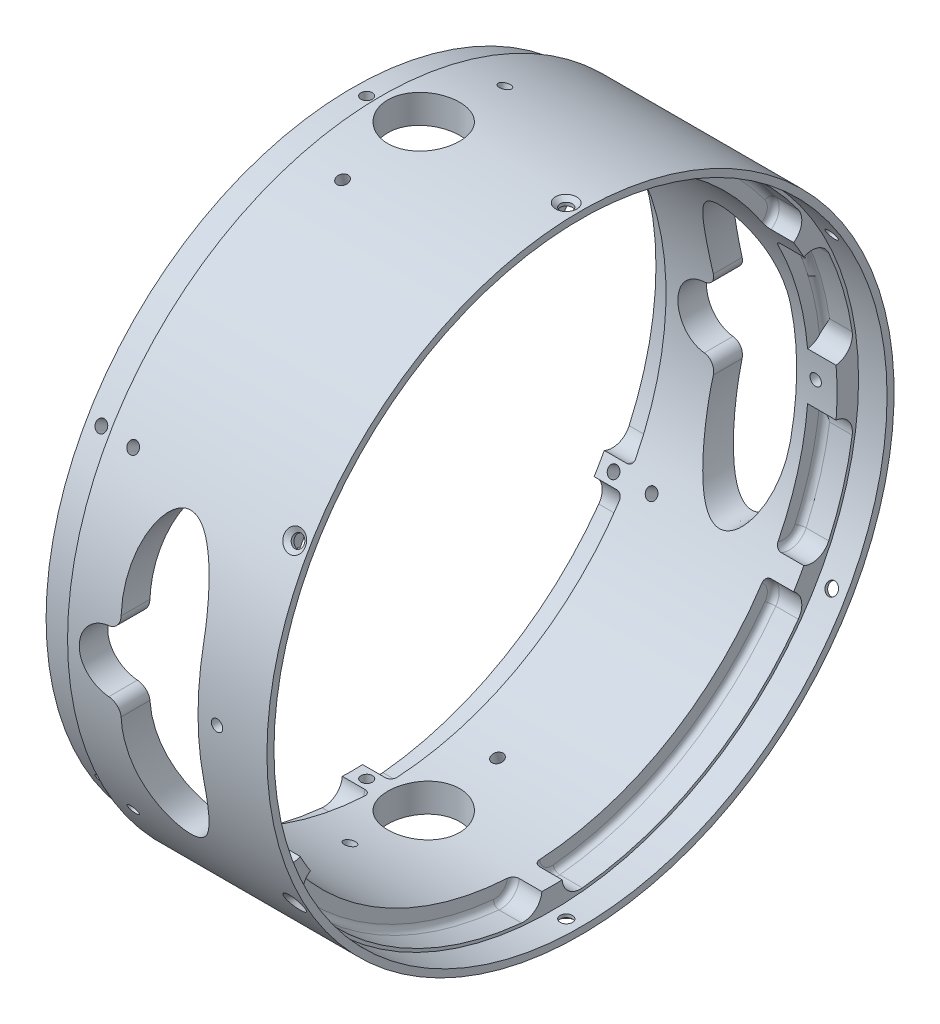
from build123d import *
from build123d.topology import SkipClean

# Parameters (mm, degrees)
F_31_0_12_DIAMETER_HOLE1_REACH                    = 196.298
F_31_0_12_DIAMETER_HOLE1_BORE_R                   = 1.524
CIRPATTERN4_COUNT                                 = 6
CUT_EXTRUDE1_DEPTH                                = 7.62
CUT_EXTRUDE2_START                                = -7.62
CUT_EXTRUDE2_DEPTH                                = 7.62
FILLET1_R                                         = 1.5875
CIRPATTERN6_COUNT                                 = 6
FILLET1_OF_CIRPATTERN6_R                          = 1.5875
CSK_FOR_4_FLAT_HEAD_MACHINE_SCREW_100_D           = 3.2639
CSK_FOR_4_FLAT_HEAD_MACHINE_SCREW_100_CSINK_D     = 5.715
CSK_FOR_4_FLAT_HEAD_MACHINE_SCREW_100_CSINK_ANGLE = 100
CIRPATTERN5_COUNT                                 = 6
CUT_EXTRUDE5_DEPTH                                = 148.905795136
CUT_EXTRUDE5_DEPTH_BACK                           = 148.905795136
CUT_EXTRUDE13_DEPTH                               = 130.987462642
CUT_EXTRUDE13_DEPTH_BACK                          = 130.987462642
SKETCH23_R                                        = 9.5885
BOSS_EXTRUDE1_REACH                               = 190.354
F_31_START                                        = -158
F_31_0_12_DIAMETER_HOLE2_OUTLINE_R                = 1.524
F_31_0_12_DIAMETER_HOLE2_DEPTH                    = 9
F_31_0_12_DIAMETER_HOLE2_2_OUTLINE_R              = 1.524
F_31_0_12_DIAMETER_HOLE2_2_DEPTH                  = 9
F_31_START_2                                      = -123
F_31_0_12_DIAMETER_HOLE2_3_OUTLINE_R              = 1.524
F_31_0_12_DIAMETER_HOLE2_3_DEPTH                  = 10
F_31_START_3                                      = 37
F_31_0_12_DIAMETER_HOLE2_4_OUTLINE_R              = 1.524
F_31_0_12_DIAMETER_HOLE2_4_DEPTH                  = 10
F_31_START_4                                      = 75
F_31_0_12_DIAMETER_HOLE2_5_OUTLINE_R              = 1.524
F_31_0_12_DIAMETER_HOLE2_5_DEPTH                  = 10
CIRPATTERN7_COUNT                                 = 2


with BuildPart() as part:
    # Sketch1 → Revolve2 (revolve)
    with BuildSketch(Plane.XY, mode=Mode.PRIVATE) as revolve2_sk:
        Polygon((-0.762, 7.62), (7.62, 7.62), (7.62, 5.7404), (0, 5.7404), (0, 0), (-53.34, 0), (-53.34, 5.6896), (-45.6692, 5.6896), (-45.6692, 7.62), align=None)
    revolve(revolve2_sk.sketch.rotate(Axis((-51.956158524, -76.2, 0), (1, 0, 0)), 90), axis=Axis((-51.956158524, -76.2, 0), (1, 0, 0)))

    # #31 (0.12) Diameter Hole1 bore (on position points) → #31 (0.12) Diameter Hole1 (cut, up to next)
    with BuildSketch(Plane(origin=(-49.53, -158.0896, 0), x_dir=(0, 0, -1), z_dir=(0, -1, 0)), mode=Mode.PRIVATE) as f_31_0_12_diameter_hole1_sk1:
        Circle(F_31_0_12_DIAMETER_HOLE1_BORE_R)
    f_31_0_12_diameter_hole1_tool1 = extrude(f_31_0_12_diameter_hole1_sk1.sketch, amount=-F_31_0_12_DIAMETER_HOLE1_REACH, mode=Mode.PRIVATE) & part.part
    f_31_0_12_diameter_hole1 = f_31_0_12_diameter_hole1_tool1.solids().sort_by_distance((-49.53, -158.0896, 0))[0]
    add(f_31_0_12_diameter_hole1, mode=Mode.SUBTRACT)

    # CirPattern4: #31 (0.12) Diameter Hole1 ×6 about axis
    cirpattern4_axis = Axis((0, -76.2, 0), (1, 0, 0))
    for i in range(1, CIRPATTERN4_COUNT):
        add(f_31_0_12_diameter_hole1.rotate(cirpattern4_axis, i * 360 / CIRPATTERN4_COUNT), mode=Mode.SUBTRACT)

    # Sketch8 → Cut-Extrude1 (cut)
    with BuildSketch(Plane.ZY.offset(53.34)):
        with BuildLine():
            ThreePointArc((-64.590076174, -116.629717533), (-66.692018058, -119.849215758), (-65.841049379, -123.598773174))
            ThreePointArc((-65.841049379, -123.598773174), (-40.5638, -146.458562548), (-8.128016987, -156.919407961))
            ThreePointArc((-8.128016987, -156.919407961), (-4.455320673, -155.781589747), (-2.718124364, -152.351505566))
            ThreePointArc((-2.718124364, -152.351505566), (-38.1, -142.191135768), (-64.590076174, -116.629717533))
        make_face()
    cut_extrude1 = extrude(amount=-CUT_EXTRUDE1_DEPTH, mode=Mode.SUBTRACT)

    # Sketch13 → Cut-Extrude2 (cut)
    with BuildSketch(Plane(origin=(0, 0, 0), x_dir=(0, 0, -1), z_dir=(1, 0, 0)).offset(CUT_EXTRUDE2_START)):
        with BuildLine():
            ThreePointArc((64.590076174, -116.629717533), (38.1, -142.191135768), (2.718124364, -152.351505566))
            ThreePointArc((2.718124364, -152.351505566), (4.455320673, -155.781589747), (8.128016987, -156.919407961))
            ThreePointArc((8.128016987, -156.919407961), (40.5638, -146.458562548), (65.841049379, -123.598773174))
            ThreePointArc((65.841049379, -123.598773174), (66.692018058, -119.849215758), (64.590076174, -116.629717533))
        make_face()
    cut_extrude2 = extrude(amount=CUT_EXTRUDE2_DEPTH, mode=Mode.SUBTRACT)

    # Fillet1
    fillet1_edges = [part.edges().sort_by_distance(p)[0] for p in [
        (-45.72, -146.458562548, -40.5638),
        (-45.72, -119.849215758, -66.692018058),
        (-45.72, -155.781589747, -4.455320673),
        (-7.62, -155.781589747, -4.455320673),
        (-7.62, -119.849215758, -66.692018058),
        (-7.62, -146.458562548, -40.5638),
    ]]
    fillet(fillet1_edges, radius=FILLET1_R)

    # CirPattern6: Cut-Extrude1, Cut-Extrude2 ×6 about axis
    cirpattern6_axis = Axis((0, -76.2, 0), (1, 0, 0))
    add([cut_extrude1.rotate(cirpattern6_axis, i * 360 / CIRPATTERN6_COUNT) for i in range(1, CIRPATTERN6_COUNT)], mode=Mode.SUBTRACT)
    add([cut_extrude2.rotate(cirpattern6_axis, i * 360 / CIRPATTERN6_COUNT) for i in range(1, CIRPATTERN6_COUNT)], mode=Mode.SUBTRACT)

    # Fillet1 of CirPattern6
    fillet1_of_cirpattern6_edges = [part.edges().sort_by_distance(p)[0] for p in [
        (-45.72, -76.2, -81.1276),
        (-45.72, -40.267626011, -71.147338731),
        (-45.72, -112.132373989, -71.147338731),
        (-7.62, -112.132373989, -71.147338731),
        (-7.62, -40.267626011, -71.147338731),
        (-7.62, -76.2, -81.1276),
        (-45.72, -5.941437452, -40.5638),
        (-45.72, 3.381589747, -4.455320673),
        (-45.72, -32.550784242, -66.692018058),
        (-7.62, -32.550784242, -66.692018058),
        (-7.62, 3.381589747, -4.455320673),
        (-7.62, -5.941437452, -40.5638),
        (-45.72, -5.941437452, 40.5638),
        (-45.72, -32.550784242, 66.692018058),
        (-45.72, 3.381589747, 4.455320673),
        (-7.62, 3.381589747, 4.455320673),
        (-7.62, -32.550784242, 66.692018058),
        (-7.62, -5.941437452, 40.5638),
        (-45.72, -76.2, 81.1276),
        (-45.72, -112.132373989, 71.147338731),
        (-45.72, -40.267626011, 71.147338731),
        (-7.62, -40.267626011, 71.147338731),
        (-7.62, -112.132373989, 71.147338731),
        (-7.62, -76.2, 81.1276),
        (-45.72, -146.458562548, 40.5638),
        (-45.72, -155.781589747, 4.455320673),
        (-45.72, -119.849215758, 66.692018058),
        (-7.62, -119.849215758, 66.692018058),
        (-7.62, -155.781589747, 4.455320673),
        (-7.62, -146.458562548, 40.5638),
    ]]
    fillet(fillet1_of_cirpattern6_edges, radius=FILLET1_OF_CIRPATTERN6_R)

    # CSK for #4 Flat Head Machine Screw (100)1 (through all)
    with Locations(Plane(origin=(3.81, -160.02, 0), x_dir=(0, 0, -1), z_dir=(0, -1, 0))):
        with Locations((0, 0)):
            csk_for_4_flat_head_machine_screw_100 = CounterSinkHole(CSK_FOR_4_FLAT_HEAD_MACHINE_SCREW_100_D / 2, CSK_FOR_4_FLAT_HEAD_MACHINE_SCREW_100_CSINK_D / 2, counter_sink_angle=CSK_FOR_4_FLAT_HEAD_MACHINE_SCREW_100_CSINK_ANGLE)

    # CirPattern5: CSK for #4 Flat Head Machine Screw (100)1 ×6 about axis
    cirpattern5_axis = Axis((7.62, -76.2, 0), (-1, 0, 0))
    for i in range(1, CIRPATTERN5_COUNT):
        add(csk_for_4_flat_head_machine_screw_100.rotate(cirpattern5_axis, i * 360 / CIRPATTERN5_COUNT), mode=Mode.SUBTRACT)

    # Sketch22 → Cut-Extrude5 (cut, two sides: drawn at the far end of the back side and taken through both)
    with BuildSketch(Plane(origin=(12.465755717, -76.935542211, -18.141203309), x_dir=(1, 0, 0), z_dir=(0, 0, 1)).offset(-CUT_EXTRUDE5_DEPTH_BACK)):
        with BuildLine():
            ThreePointArc((-44.645862848, -10.958742352), (-45.356953283, -8.624882812), (-47.513859586, -7.484573575))
            ThreePointArc((-47.513859586, -7.484573575), (-55.010755717, 0.735542211), (-47.513859586, 8.955657996))
            ThreePointArc((-47.513859586, 8.955657996), (-45.356953283, 10.095967233), (-44.645862848, 12.429826773))
            add(Edge.make_bspline(
                [(-23.260755717, 16.62042399), (-23.260755717, 40.42922599), (-35.108647383, 38.10752886), (-46.956539048, 35.785831731), (-44.645862848, 12.429826773)],
                knots=[4.71238898, 4.71238898, 4.71238898, 6.380854752, 6.380854752, 8.049320524, 8.049320524, 8.049320524], degree=2, weights=[1, 0.671746144, 1, 0.671746144, 1]))
            Line((-23.260755717, 16.62042399), (-23.260755717, -15.149339569))
            add(Edge.make_bspline(
                [(-44.645862848, -10.958742352), (-46.956539048, -34.31474731), (-35.108647383, -36.636444439), (-23.260755717, -38.958141569), (-23.260755717, -15.149339569)],
                knots=[4.51705009, 4.51705009, 4.51705009, 6.185515862, 6.185515862, 7.853981634, 7.853981634, 7.853981634], degree=2, weights=[1, 0.671746144, 1, 0.671746144, 1]))
        make_face()
    extrude(amount=CUT_EXTRUDE5_DEPTH + CUT_EXTRUDE5_DEPTH_BACK, mode=Mode.SUBTRACT)

    # Sketch23 → Cut-Extrude13 (cut, two sides: drawn at the far end of the back side and taken through both)
    with BuildSketch(Plane(origin=(0, -76.2, 0), x_dir=(1, 0, 0), z_dir=(0, 1, 0)).offset(-CUT_EXTRUDE13_DEPTH_BACK)):
        with Locations(Location((-34.29, 0, 0), (0, 0, 270))):
            Circle(SKETCH23_R)
    extrude(amount=CUT_EXTRUDE13_DEPTH + CUT_EXTRUDE13_DEPTH_BACK, mode=Mode.SUBTRACT)

    # Sketch25 → Boss-Extrude1 (add, up to next)
    with BuildSketch(Plane(origin=(0, 0, 0), x_dir=(0, 0, -1), z_dir=(1, 0, 0)), mode=Mode.PRIVATE) as boss_extrude1_sk1:
        with BuildLine():
            ThreePointArc((-75.934955719, -69.85), (-76.2, -76.2), (-75.934955719, -82.55))
            ThreePointArc((-75.934955719, -82.55), (-79.278207608, -84.448945843), (-80.239418371, -88.171767672))
            ThreePointArc((-80.239418371, -88.171767672), (-81.1276, -76.2), (-80.239418371, -64.228232328))
            ThreePointArc((-80.239418371, -64.228232328), (-79.278207608, -67.951054157), (-75.934955719, -69.85))
        make_face()
    boss_extrude1_tool1 = extrude(boss_extrude1_sk1.sketch, amount=-BOSS_EXTRUDE1_REACH, mode=Mode.PRIVATE) - part.part
    # Sketch25 → Boss-Extrude1 (add, up to next)
    with BuildSketch(Plane(origin=(0, 0, 0), x_dir=(0, 0, -1), z_dir=(1, 0, 0)), mode=Mode.PRIVATE) as boss_extrude1_sk2:
        with BuildLine():
            ThreePointArc((75.934955719, -69.85), (79.278207608, -67.951054157), (80.239418371, -64.228232328))
            ThreePointArc((80.239418371, -64.228232328), (81.1276, -76.2), (80.239418371, -88.171767672))
            ThreePointArc((80.239418371, -88.171767672), (79.278207608, -84.448945843), (75.934955719, -82.55))
            ThreePointArc((75.934955719, -82.55), (76.2, -76.2), (75.934955719, -69.85))
        make_face()
    boss_extrude1_tool2 = extrude(boss_extrude1_sk2.sketch, amount=-BOSS_EXTRUDE1_REACH, mode=Mode.PRIVATE) - part.part
    add(boss_extrude1_tool1.solids().sort_by_distance((0, -76.2, 78.749805))[0])
    add(boss_extrude1_tool2.solids().sort_by_distance((0, -76.2, -78.749805))[0])

    # #31 (0.12) Diameter Hole2: read off the stored shape, not the designer's step
    # #31 (0.12) Diameter Hole2 outline → #31 (0.12) Diameter Hole2 (cut)
    with SkipClean():  # the faces are left unmerged after this step: merging them gives an invalid solid
        with BuildSketch(Plane(origin=(0, 0, 0), x_dir=(1, 0, 0), z_dir=(0, 0.9659258262890699, -0.258819045102515)).offset(F_31_START)):
            with Locations((-34.29, 19.722011237)):
                Circle(F_31_0_12_DIAMETER_HOLE2_OUTLINE_R)
        f_31_0_12_diameter_hole2 = extrude(amount=F_31_0_12_DIAMETER_HOLE2_DEPTH, mode=Mode.SUBTRACT)

    # 31 _0.12_ Diameter Hole2 2 outline → 31 _0.12_ Diameter Hole2 2 (cut)
    with SkipClean():  # the faces are left unmerged after this step: merging them gives an invalid solid
        with BuildSketch(Plane(origin=(0, 0, 0), x_dir=(1, 0, 0), z_dir=(0, 0.9659258262890696, 0.25881904510251597)).offset(F_31_START)):
            with Locations((-34.29, -19.722011237)):
                Circle(F_31_0_12_DIAMETER_HOLE2_2_OUTLINE_R)
        f_31_0_12_diameter_hole2_2 = extrude(amount=F_31_0_12_DIAMETER_HOLE2_2_DEPTH, mode=Mode.SUBTRACT)

    # 31 _0.12_ Diameter Hole2 3 outline → 31 _0.12_ Diameter Hole2 3 (cut)
    with SkipClean():  # the faces are left unmerged after this step: merging them gives an invalid solid
        with BuildSketch(Plane(origin=(0, 0, 0), x_dir=(1, 0, 0), z_dir=(0, 0.49996809917136886, -0.8660438209530558)).offset(F_31_START_2)):
            with Locations((-39.37, 65.992539157)):
                Circle(F_31_0_12_DIAMETER_HOLE2_3_OUTLINE_R)
        f_31_0_12_diameter_hole2_3 = extrude(amount=F_31_0_12_DIAMETER_HOLE2_3_DEPTH, mode=Mode.SUBTRACT)

    # 31 _0.12_ Diameter Hole2 4 outline → 31 _0.12_ Diameter Hole2 4 (cut)
    with SkipClean():  # the faces are left unmerged after this step: merging them gives an invalid solid
        with BuildSketch(Plane(origin=(0, 0, 0), x_dir=(1, 0, 0), z_dir=(0, 0.4999680991713681, 0.8660438209530562)).offset(F_31_START_3)):
            with Locations((-39.37, -65.992539157)):
                Circle(F_31_0_12_DIAMETER_HOLE2_4_OUTLINE_R)
        f_31_0_12_diameter_hole2_4 = extrude(amount=F_31_0_12_DIAMETER_HOLE2_4_DEPTH, mode=Mode.SUBTRACT)

    # 31 _0.12_ Diameter Hole2 5 outline → 31 _0.12_ Diameter Hole2 5 (cut)
    with SkipClean():  # the faces are left unmerged after this step: merging them gives an invalid solid
        with BuildSketch(Plane.XY.offset(F_31_START_4)):
            with Locations((-5.715, -76.2)):
                Circle(F_31_0_12_DIAMETER_HOLE2_5_OUTLINE_R)
        f_31_0_12_diameter_hole2_5 = extrude(amount=F_31_0_12_DIAMETER_HOLE2_5_DEPTH, mode=Mode.SUBTRACT)

    # CirPattern7: #31 (0.12) Diameter Hole2, 31 _0.12_ Diameter Hole2 2, 31 _0.12_ Diameter Hole2 3, 31 _0.12_ Diameter Hole2 4, 31 _0.12_ Diameter Hole2 5 ×2 about axis
    with SkipClean():  # the faces are left unmerged after this step: merging them gives an invalid solid
        cirpattern7_axis = Axis((7.62, -76.2, 0), (-1, 0, 0))
        add([f_31_0_12_diameter_hole2.rotate(cirpattern7_axis, i * 360 / CIRPATTERN7_COUNT) for i in range(1, CIRPATTERN7_COUNT)], mode=Mode.SUBTRACT)
        add([f_31_0_12_diameter_hole2_2.rotate(cirpattern7_axis, i * 360 / CIRPATTERN7_COUNT) for i in range(1, CIRPATTERN7_COUNT)], mode=Mode.SUBTRACT)
        add([f_31_0_12_diameter_hole2_3.rotate(cirpattern7_axis, i * 360 / CIRPATTERN7_COUNT) for i in range(1, CIRPATTERN7_COUNT)], mode=Mode.SUBTRACT)
        add([f_31_0_12_diameter_hole2_4.rotate(cirpattern7_axis, i * 360 / CIRPATTERN7_COUNT) for i in range(1, CIRPATTERN7_COUNT)], mode=Mode.SUBTRACT)
        add([f_31_0_12_diameter_hole2_5.rotate(cirpattern7_axis, i * 360 / CIRPATTERN7_COUNT) for i in range(1, CIRPATTERN7_COUNT)], mode=Mode.SUBTRACT)


solid = part.part
